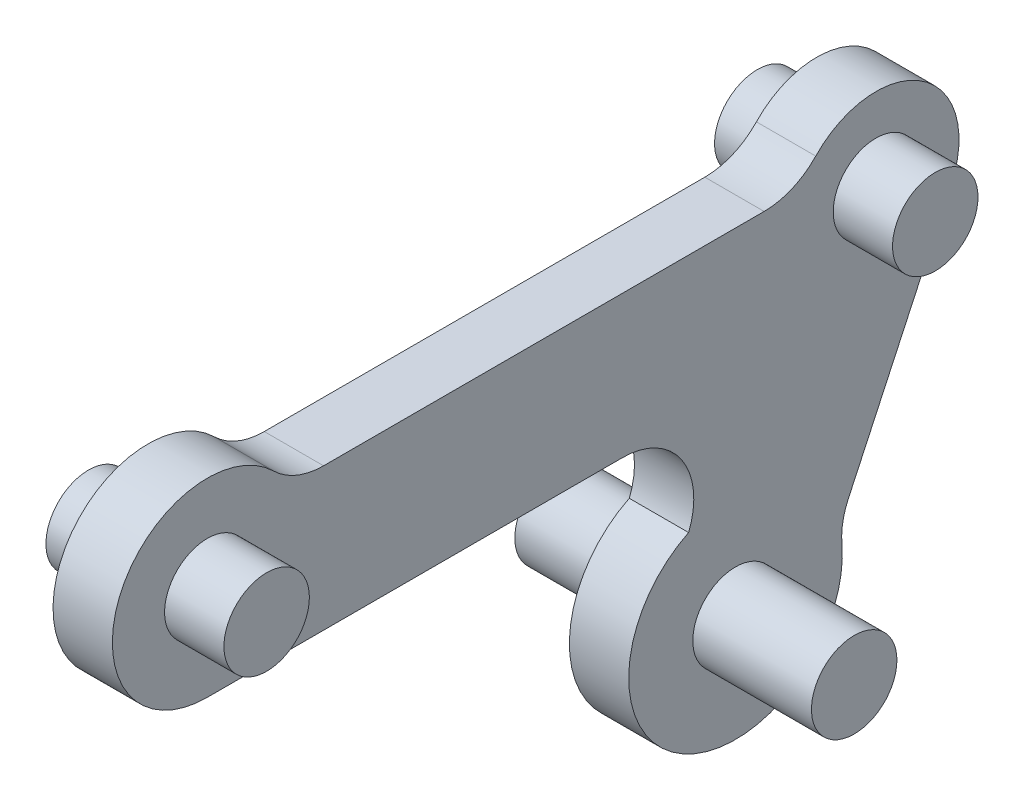
from build123d import *

# Parameters (mm, degrees)
EXTRUDE_1_DEPTH     = 1.25
SKETCH_1_3_R        = 2
CUT_EXTRUDE_1_DEPTH = 37.497164572
FILLET_1_R          = 3
EXTRUDE_START       = -1.25
SKETCH_2_R          = 2
EXTRUDE_2_DEPTH     = 1.25
SKETCH_2_5_R        = 1.8
EXTRUDE_5_DEPTH     = 2.5
SKETCH_2_7_R        = 1.8
EXTRUDE_7_DEPTH     = 5


with BuildPart() as part:
    # 草图1 → 凸台-拉伸1 (new body)
    with BuildSketch(Plane(origin=(0, 0, 0), x_dir=(0, 0, -1), z_dir=(1, 0, 0))):
        with BuildLine():
            Line((-28.172077255, -4.520836084), (-28.172077255, 1.479163916))
            Line((-28.172077255, 1.479163916), (-24.707975639, 1.479163916))
            ThreePointArc((-24.707975639, 1.479163916), (-31.63617887, 1.479163916), (-28.172077255, -4.520836084))
        make_face()
        with BuildLine():
            Line((-24.707975639, 1.479163916), (-28.172077255, 1.479163916))
            Line((-28.172077255, 1.479163916), (-28.172077255, -4.520836084))
            ThreePointArc((-28.172077255, -4.520836084), (-25.34365013, -3.349263209), (-24.172077255, -0.520836084))
            ThreePointArc((-24.172077255, -0.520836084), (-24.308373949, 0.514440097), (-24.707975639, 1.479163916))
        make_face()
        with BuildLine():
            Line((-3.172077255, 1.479163916), (-24.707975639, 1.479163916))
            ThreePointArc((-24.707975639, 1.479163916), (-24.308373949, 0.514440097), (-24.172077255, -0.520836084))
            ThreePointArc((-24.172077255, -0.520836084), (-25.34365013, -3.349263209), (-28.172077255, -4.520836084))
            Line((-28.172077255, -4.520836084), (-5.969923204, -4.520836084))
            Line((-5.969923204, -4.520836084), (-3.172077255, 1.479163916))
        make_face()
        with BuildLine():
            Line((3.172077255, -1.479163916), (-3.172077255, 1.479163916))
            Line((-3.172077255, 1.479163916), (-3.172077255, -1.479163916))
            ThreePointArc((-3.172077255, -1.479163916), (0, -3.5), (3.172077255, -1.479163916))
        make_face()
        with BuildLine():
            ThreePointArc((3.5, 0), (0.757538649, 3.417036025), (-3.172077255, 1.479163916))
            Line((-3.172077255, 1.479163916), (3.172077255, -1.479163916))
            ThreePointArc((3.172077255, -1.479163916), (3.417036025, -0.757538649), (3.5, 0))
        make_face()
        with BuildLine():
            ThreePointArc((-3.172077255, -1.479163916), (-3.5, 0), (-3.172077255, 1.479163916))
            Line((-3.172077255, 1.479163916), (-5.969923204, -4.520836084))
            Line((-5.969923204, -4.520836084), (-3.172077255, -4.520836084))
            Line((-3.172077255, -4.520836084), (-3.172077255, -1.479163916))
        make_face()
        with BuildLine():
            Line((-3.172077255, -1.479163916), (-3.172077255, 1.479163916))
            ThreePointArc((-3.172077255, 1.479163916), (-3.5, 0), (-3.172077255, -1.479163916))
        make_face()
        with BuildLine():
            Line((-3.172077255, -4.520836084), (-5.969923204, -4.520836084))
            Line((-5.969923204, -4.520836084), (-7.893387964, -8.645719574))
            ThreePointArc((-7.893387964, -8.645719574), (-4.014873487, -8.609923977), (-1.549233455, -11.604047406))
            Line((-1.549233455, -11.604047406), (3.172077255, -1.479163916))
            ThreePointArc((3.172077255, -1.479163916), (0, -3.5), (-3.172077255, -1.479163916))
            Line((-3.172077255, -1.479163916), (-3.172077255, -4.520836084))
        make_face()
        with BuildLine():
            ThreePointArc((-1.549233455, -11.604047406), (-4.014873487, -8.609923977), (-7.893387964, -8.645719574))
            Line((-7.893387964, -8.645719574), (-9.088732919, -11.209145102))
            Line((-9.088732919, -11.209145102), (-2.74457841, -14.167472935))
            Line((-2.74457841, -14.167472935), (-1.549233455, -11.604047406))
        make_face()
        with BuildLine():
            Line((-9.088732919, -11.209145102), (-7.893387964, -8.645719574))
            ThreePointArc((-7.893387964, -8.645719574), (-8.299375187, -16.50572276), (-1.416655664, -12.688309019))
            ThreePointArc((-1.416655664, -12.688309019), (-1.449923081, -12.14214052), (-1.549233455, -11.604047406))
            Line((-1.549233455, -11.604047406), (-2.74457841, -14.167472935))
            Line((-2.74457841, -14.167472935), (-9.088732919, -11.209145102))
        make_face()
    extrude(amount=EXTRUDE_1_DEPTH)

    # 草图1<3> → 切除-拉伸1 (cut, through all)
    with BuildSketch(Plane(origin=(0, 0, 0), x_dir=(0, 0, -1), z_dir=(1, 0, 0))):
        with Locations((-28.172077255, -0.520836084)):
            Circle(SKETCH_1_3_R)
        Circle(SKETCH_1_3_R)
        with Locations((-5.916655664, -12.688309019)):
            Circle(SKETCH_1_3_R)
    extrude(amount=CUT_EXTRUDE_1_DEPTH, mode=Mode.SUBTRACT)

    # 圆角1
    # the kernel refuses this fillet: 3 mm, written as the material it adds along each edge
    with BuildSketch(Plane(origin=(0, -11.604047406, 1.549233455), x_dir=(0, 0.9063077870366663, -0.4226182617406644), z_dir=(1, 0, 0))) as fillet_1_piece_1:
        with BuildLine():
            CenterArc((0.913230262, -3), FILLET_1_R, 90, 29.926434867)
            Line((-0.583432693, -0.4), (-0.613365952, -0.348))
            ThreePointArc((-0.613365952, -0.348), (-0.317772106, -0.161995545), (-0.037712362, 0.046666667))
            Line((-0.037712362, 0.046666667), (0, 0.06))
            Line((0, 0.06), (0.913230262, 0.06))
            Line((0.913230262, 0.06), (0.913230262, 0))
        make_face()
    extrude(amount=1.25)
    with BuildSketch(Plane(origin=(0, 1.479163916, 3.172077255), x_dir=(0, 0, 1), z_dir=(1, 0, 0))) as fillet_1_piece_2:
        with BuildLine():
            CenterArc((1.538240209, -3), FILLET_1_R, 90, 46.440922497)
            Line((-0.635752466, -0.932693577), (-0.67923232, -0.891347449))
            ThreePointArc((-0.67923232, -0.891347449), (-0.329607023, -0.458350724), (-0.054378467, 0.025357096))
            Line((-0.054378467, 0.025357096), (0, 0.06))
            Line((0, 0.06), (1.538240209, 0.06))
            Line((1.538240209, 0.06), (1.538240209, 0))
        make_face()
    extrude(amount=1.25)
    with BuildSketch(Plane(origin=(0, 1.479163916, 24.707975639), x_dir=(0, 0.7902368852402469, 0.6128014892326821), z_dir=(1, 0, 0))) as fillet_1_piece_3:
        with BuildLine():
            CenterArc((1.49141536, -2.972297887), FILLET_1_R, 97.792345701, 44.415308597)
            Line((-0.879295296, -1.133893419), (-0.926709509, -1.09712533))
            Line((-0.926709509, -1.09712533), (-0.047414213, 0.036768089))
            Line((-0.047414213, 0.036768089), (0.008134993, 0.059445958))
            ThreePointArc((0.008134993, 0.059445958), (0.542332858, 0.023063849), (1.076530723, 0.059445958))
            Line((1.076530723, 0.059445958), (1.084665716, 0))
        make_face()
    extrude(amount=1.25)
    with BuildSketch(Plane(origin=(0, -4.520836084, 5.969923204), x_dir=(0, 0, 1), z_dir=(1, 0, 0))) as fillet_1_piece_4:
        with BuildLine():
            CenterArc((4.704586321, 3), FILLET_1_R, 157.978087479, 112.021912521)
            Line((1.923464761, 4.12488349), (1.867842329, 4.14738116))
            ThreePointArc((1.867842329, 4.14738116), (0.907353913, 2.087798841), (-0.054378467, 0.025357096))
            Line((-0.054378467, 0.025357096), (0, -0.06))
            Line((0, -0.06), (4.704586321, -0.06))
            Line((4.704586321, -0.06), (4.704586321, 0))
        make_face()
    extrude(amount=1.25)

    # 草图2 → 凸台-拉伸2 (add)
    with BuildSketch(Plane(origin=(1.25, 0, 0), x_dir=(0, 0, -1), z_dir=(1, 0, 0)).offset(EXTRUDE_START)):
        Circle(SKETCH_2_R)
        with Locations((-5.916655664, -12.688309019)):
            Circle(SKETCH_2_R)
        with Locations((-28.172077255, -0.520836084)):
            Circle(SKETCH_2_R)
    extrude(amount=EXTRUDE_2_DEPTH)

    # 草图2<5> → 凸台-拉伸5 (add)
    with BuildSketch(Plane(origin=(1.25, 0, 0), x_dir=(0, 0, -1), z_dir=(1, 0, 0))):
        with Locations((-28.172077255, -0.520836084)):
            Circle(SKETCH_2_5_R)
        Circle(SKETCH_2_5_R)
    extrude(amount=EXTRUDE_5_DEPTH)

    # 草图2<7> → 凸台-拉伸7 (add)
    with BuildSketch(Plane(origin=(1.25, 0, 0), x_dir=(0, 0, -1), z_dir=(1, 0, 0))):
        with Locations((-5.916655664, -12.688309019)):
            Circle(SKETCH_2_7_R)
    extrude(amount=EXTRUDE_7_DEPTH)

    # 镜向1: part across plane


with BuildPart() as part_1:
    add(part.part)
    add(part.part.mirror(Plane.ZY))


solid = part_1.part
